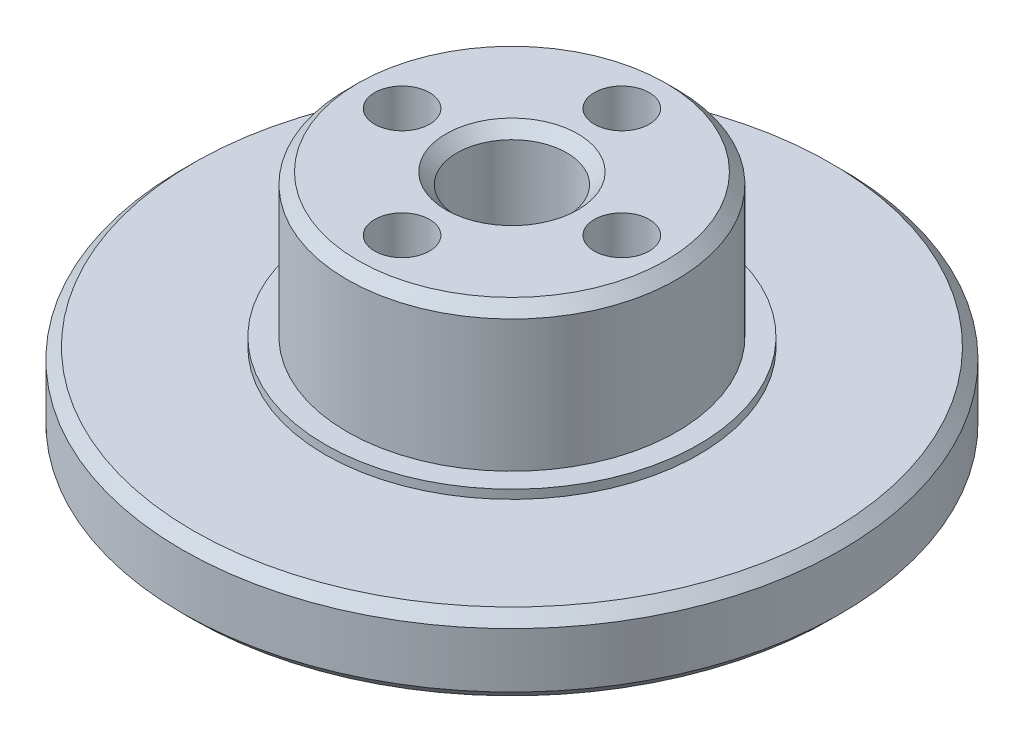
from build123d import *

# Parameters (mm, degrees)
SKETCH_1_R          = 15
SKETCH_1_R_2        = 2
EXTRUDE_1_DEPTH     = 2
SKETCH_2_R          = 15
EXTRUDE_2_DEPTH     = 1.5
SKETCH_3_R          = 8.5
EXTRUDE_3_DEPTH     = 0.4
SKETCH_4_R          = 7.5
EXTRUDE_4_DEPTH     = 6.5
SKETCH_5_R          = 1.25
SKETCH_5_R_2        = 2.5
CUT_EXTRUDE_1_DEPTH = 5
CHAMFER_1_SIZE      = 0.5
SKETCH_7_R          = 2.5
CUT_EXTRUDE_4_DEPTH = 22.889723616
SKETCH_8_R          = 6
CUT_EXTRUDE_5_DEPTH = 2
CHAMFER_2_SIZE      = 0.5


with BuildPart() as part:
    # 草图1 → 凸台-拉伸1 (new body)
    with BuildSketch(Plane(origin=(0, 0, 0), x_dir=(1, 0, 0), z_dir=(0, 1, 0))):
        Circle(SKETCH_1_R)
        with Locations((0, 11.525)):
            Circle(SKETCH_1_R_2, mode=Mode.SUBTRACT)
        with Locations((9.980942779, 5.7625)):
            Circle(SKETCH_1_R_2, mode=Mode.SUBTRACT)
        with Locations((9.980942779, -5.7625)):
            Circle(SKETCH_1_R_2, mode=Mode.SUBTRACT)
        with Locations((0, -11.525)):
            Circle(SKETCH_1_R_2, mode=Mode.SUBTRACT)
        with Locations((-9.980942779, -5.7625)):
            Circle(SKETCH_1_R_2, mode=Mode.SUBTRACT)
        with Locations((-9.980942779, 5.7625)):
            Circle(SKETCH_1_R_2, mode=Mode.SUBTRACT)
    extrude(amount=EXTRUDE_1_DEPTH)

    # 草图2 → 凸台-拉伸2 (add)
    with BuildSketch(Plane(origin=(0, 2, 0), x_dir=(1, 0, 0), z_dir=(0, 1, 0))):
        Circle(SKETCH_2_R)
    extrude(amount=EXTRUDE_2_DEPTH)

    # 草图3 → 凸台-拉伸3 (add)
    with BuildSketch(Plane(origin=(0, 3.5, 0), x_dir=(1, 0, 0), z_dir=(0, 1, 0))):
        Circle(SKETCH_3_R)
    extrude(amount=EXTRUDE_3_DEPTH)

    # 草图4 → 凸台-拉伸4 (add)
    with BuildSketch(Plane(origin=(0, 3.9, 0), x_dir=(1, 0, 0), z_dir=(0, 1, 0))):
        Circle(SKETCH_4_R)
    extrude(amount=EXTRUDE_4_DEPTH)

    # 草图5 → 切除-拉伸1 (cut)
    with BuildSketch(Plane(origin=(0, 10.4, 0), x_dir=(1, 0, 0), z_dir=(0, 1, 0))):
        with Locations((0, 5)):
            Circle(SKETCH_5_R)
        with Locations((5, 0)):
            Circle(SKETCH_5_R)
        with Locations((0, -5)):
            Circle(SKETCH_5_R)
        with Locations((-5, 0)):
            Circle(SKETCH_5_R)
        Circle(SKETCH_5_R_2)
    extrude(amount=-CUT_EXTRUDE_1_DEPTH, mode=Mode.SUBTRACT)

    # 倒角1
    chamfer_1_edges = [part.edges().sort_by_distance(p)[0] for p in [
        (-11.980942779, 0, -5.7625),
        (-11.980942779, 0, 5.7625),
        (-2, 0, 11.525),
        (7.980942779, 0, 5.7625),
        (7.980942779, 0, -5.7625),
        (-2, 0, -11.525),
        (-15, 0, 0),
        (-7.5, 10.4, 0),
        (-15, 3.5, 0),
        (-2.5, 10.4, 0),
    ]]
    chamfer(chamfer_1_edges, length=CHAMFER_1_SIZE)

    # 草图7 → 切除-拉伸4 (cut, through all)
    with BuildSketch(Plane(origin=(0, 5.4, 0), x_dir=(1, 0, 0), z_dir=(0, 1, 0))):
        Circle(SKETCH_7_R)
    extrude(amount=-CUT_EXTRUDE_4_DEPTH, mode=Mode.SUBTRACT)

    # 草图8 → 切除-拉伸5 (cut)
    with BuildSketch(Plane(origin=(0, 0, 0), x_dir=(-1, 0, 0), z_dir=(0, -1, 0))):
        Circle(SKETCH_8_R)
    extrude(amount=-CUT_EXTRUDE_5_DEPTH, mode=Mode.SUBTRACT)

    # 倒角2
    chamfer_2_edges = [part.edges().sort_by_distance(p)[0] for p in [
        (6, 0, 0),
        (-2.5, 2, 0),
        (6, 2, 0),
    ]]
    chamfer(chamfer_2_edges, length=CHAMFER_2_SIZE)


solid = part.part
